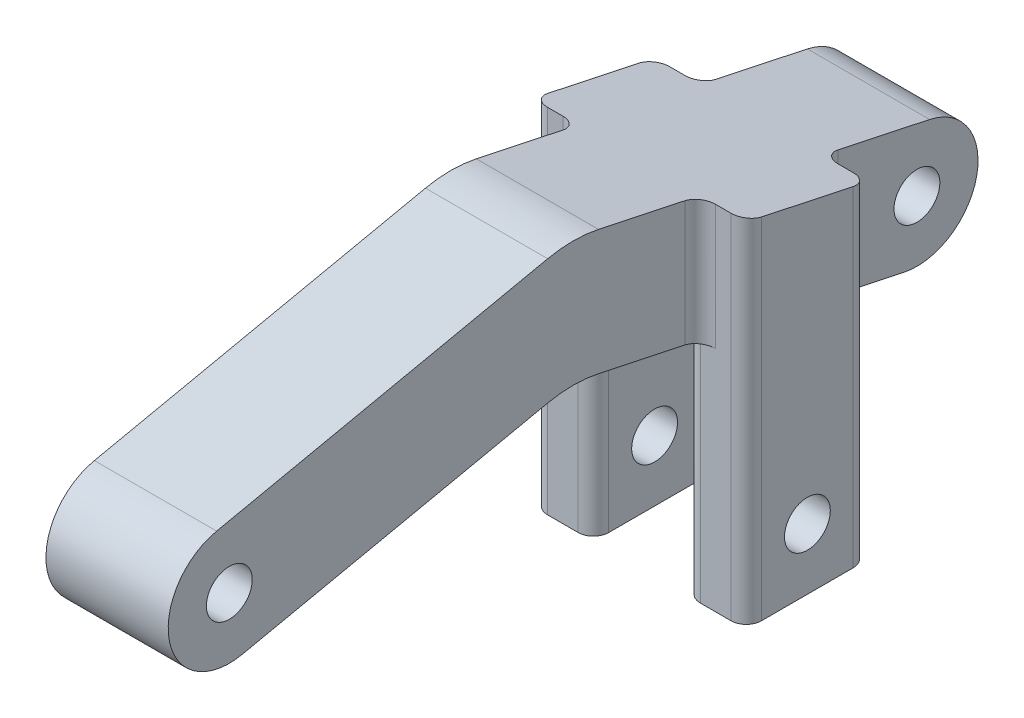
from build123d import *

# Parameters (mm, degrees)
CROQUIS1_R                          = 1.5
SALIENTE_EXTRUIR1_DEPTH             = 4
SALIENTE_EXTRUIR2_REACH             = 30.175
CROQUIS3_W                          = 3
CROQUIS3_H                          = 8
SALIENTE_EXTRUIR2_DIRECTION_2_REACH = 30.175
CROQUIS4_W                          = 14
CROQUIS4_H                          = 8
SALIENTE_EXTRUIR3_DEPTH             = 16
CORTAR_EXTRUIR2_REACH               = 38.892
CROQUIS7_W                          = 6
CROQUIS7_H                          = 8
REDONDEO1_R                         = 1
CORTAR_EXTRUIR1_DEPTH               = 32.737202145
CORTAR_EXTRUIR1_DEPTH_BACK          = 32.737202145
CROQUIS6_R                          = 1.5


with BuildPart() as part:
    # Croquis1 → Saliente-Extruir1 (new, symmetric)
    with BuildSketch(Plane(origin=(0, 0, 0), x_dir=(0, 0, -1), z_dir=(1, 0, 0))):
        with BuildLine():
            Line((-23.331646763, 3.912590403), (-1.663293527, 8.518341064))
            ThreePointArc((-1.663293527, 8.518341064), (0, 8.693160258), (1.663293527, 8.518341064))
            Line((1.663293527, 8.518341064), (23.331646763, 3.912590403))
            ThreePointArc((23.331646763, 3.912590403), (26.412590403, -0.831646763), (21.668353237, -3.912590403))
            Line((21.668353237, -3.912590403), (1.663293527, 0.339616305))
            ThreePointArc((1.663293527, 0.339616305), (0, 0.514435499), (-1.663293527, 0.339616305))
            Line((-1.663293527, 0.339616305), (-21.668353237, -3.912590403))
            ThreePointArc((-21.668353237, -3.912590403), (-26.412590403, -0.831646763), (-23.331646763, 3.912590403))
        make_face()
        with Locations((-22.5, 0)):
            Circle(CROQUIS1_R, mode=Mode.SUBTRACT)
        with Locations(Location((22.5, 0, 0), (0, 0, 180))):
            Circle(CROQUIS1_R, mode=Mode.SUBTRACT)
    extrude(amount=SALIENTE_EXTRUIR1_DEPTH, both=True)

    # Saliente-Extruir2: up to this plane
    saliente_extruir2_end = Plane(origin=(4, 0.339616305, -1.663293527), z_dir=(0, 0.9781476007338056, -0.20791169081776))
    # Croquis3 → Saliente-Extruir2 (add, up to the surface)
    with BuildSketch(Plane(origin=(0, 0, 0), x_dir=(1, 0, 0), z_dir=(0, 1, 0)), mode=Mode.PRIVATE) as saliente_extruir2_sk1:
        with Locations((-5.5, 12.331646763)):
            Rectangle(CROQUIS3_W, CROQUIS3_H)
    saliente_extruir2_tool1 = split(extrude(saliente_extruir2_sk1.sketch, amount=-SALIENTE_EXTRUIR2_REACH, mode=Mode.PRIVATE), bisect_by=saliente_extruir2_end, keep=Keep.BOTH, mode=Mode.PRIVATE)
    add(saliente_extruir2_tool1.solids().sort_by_distance((-5.5, 0, -12.331647))[0])
    # Croquis3 → Saliente-Extruir2 (add, up to the surface)
    with BuildSketch(Plane(origin=(0, 0, 0), x_dir=(1, 0, 0), z_dir=(0, 1, 0)), mode=Mode.PRIVATE) as saliente_extruir2_sk2:
        with Locations((5.5, 12.331646763)):
            Rectangle(CROQUIS3_W, CROQUIS3_H)
    saliente_extruir2_tool2 = split(extrude(saliente_extruir2_sk2.sketch, amount=-SALIENTE_EXTRUIR2_REACH, mode=Mode.PRIVATE), bisect_by=saliente_extruir2_end, keep=Keep.BOTH, mode=Mode.PRIVATE)
    add(saliente_extruir2_tool2.solids().sort_by_distance((5.5, 0, -12.331647))[0])

    # Saliente-Extruir2 direction 2: up to this plane
    saliente_extruir2_direction_2_end = Plane(origin=(4, 8.518341064, -1.663293527), z_dir=(0, -0.9781476007338056, 0.20791169081776004))
    # Croquis3 → Saliente-Extruir2 direction 2 (add, up to the surface)
    with BuildSketch(Plane(origin=(0, 0, 0), x_dir=(1, 0, 0), z_dir=(0, 1, 0)), mode=Mode.PRIVATE) as saliente_extruir2_direction_2_sk1:
        with Locations((-5.5, 12.331646763)):
            Rectangle(CROQUIS3_W, CROQUIS3_H)
    saliente_extruir2_direction_2_tool1 = split(extrude(saliente_extruir2_direction_2_sk1.sketch, amount=SALIENTE_EXTRUIR2_DIRECTION_2_REACH, mode=Mode.PRIVATE), bisect_by=saliente_extruir2_direction_2_end, keep=Keep.BOTH, mode=Mode.PRIVATE)
    add(saliente_extruir2_direction_2_tool1.solids().sort_by_distance((-5.5, 0, -12.331647))[0])
    # Croquis3 → Saliente-Extruir2 direction 2 (add, up to the surface)
    with BuildSketch(Plane(origin=(0, 0, 0), x_dir=(1, 0, 0), z_dir=(0, 1, 0)), mode=Mode.PRIVATE) as saliente_extruir2_direction_2_sk2:
        with Locations((5.5, 12.331646763)):
            Rectangle(CROQUIS3_W, CROQUIS3_H)
    saliente_extruir2_direction_2_tool2 = split(extrude(saliente_extruir2_direction_2_sk2.sketch, amount=SALIENTE_EXTRUIR2_DIRECTION_2_REACH, mode=Mode.PRIVATE), bisect_by=saliente_extruir2_direction_2_end, keep=Keep.BOTH, mode=Mode.PRIVATE)
    add(saliente_extruir2_direction_2_tool2.solids().sort_by_distance((5.5, 0, -12.331647))[0])

    # Croquis4 → Saliente-Extruir3 (add)
    with BuildSketch(Plane.XZ):
        with Locations((0, -12.331646763)):
            Rectangle(CROQUIS4_W, CROQUIS4_H)
    extrude(amount=SALIENTE_EXTRUIR3_DEPTH)

    # Cortar-Extruir2: up to this plane
    cortar_extruir2_end = Plane(origin=(4, 0.339616305, -1.663293527), z_dir=(0, 0.9781476007338056, -0.20791169081776))
    # Croquis7 → Cortar-Extruir2 (cut, up to the surface)
    with BuildSketch(Plane.XZ.offset(16), mode=Mode.PRIVATE) as cortar_extruir2_sk1:
        with Locations((0, -12.331646763)):
            Rectangle(CROQUIS7_W, CROQUIS7_H)
    cortar_extruir2_tool1 = split(extrude(cortar_extruir2_sk1.sketch, amount=-CORTAR_EXTRUIR2_REACH, mode=Mode.PRIVATE), bisect_by=cortar_extruir2_end, keep=Keep.BOTH, mode=Mode.PRIVATE)
    add(cortar_extruir2_tool1.solids().sort_by_distance((0, -16, -12.331647))[0], mode=Mode.SUBTRACT)

    # Redondeo1
    redondeo1_edges = [part.edges().sort_by_distance(p)[0] for p in [
        (4, 3.011576449, -8.331646763),
        (4, 1.311123955, -16.331646763),
        (-4, 3.011576449, -8.331646763),
        (-4, 1.311123955, -16.331646763),
        (3, -9.389119212, -16.331646763),
        (-3, -9.389119212, -16.331646763),
        (-3, -8.538892965, -8.331646763),
        (3, -8.538892965, -8.331646763),
        (7, -4.449530586, -8.331646763),
        (7, -5.299756833, -16.331646763),
        (-7, -5.299756833, -16.331646763),
        (-7, -4.449530586, -8.331646763),
    ]]
    fillet(redondeo1_edges, radius=REDONDEO1_R - 0.0001)  # a hair under: the kernel refuses the full size

    # Croquis6 → Cortar-Extruir1 (cut, two sides: drawn at the far end of the back side and taken through both)
    with BuildSketch(Plane(origin=(0, 0, 0), x_dir=(0, 0, -1), z_dir=(1, 0, 0)).offset(-CORTAR_EXTRUIR1_DEPTH_BACK)):
        with Locations((12.331646763, -12)):
            Circle(CROQUIS6_R)
    extrude(amount=CORTAR_EXTRUIR1_DEPTH + CORTAR_EXTRUIR1_DEPTH_BACK, mode=Mode.SUBTRACT)


solid = part.part
